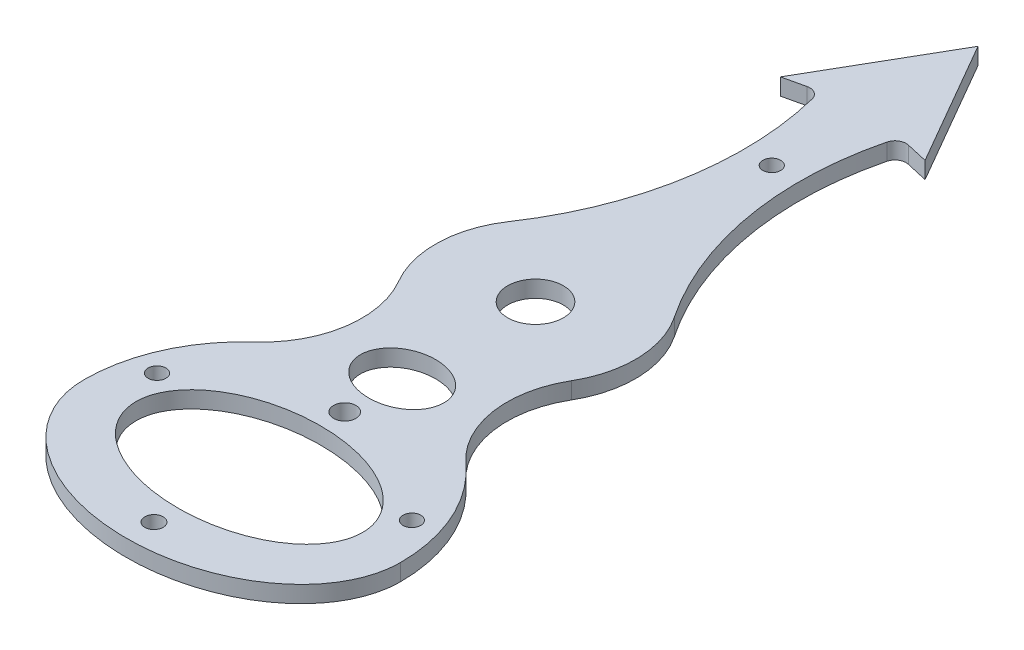
from build123d import *

# Parameters (mm, degrees)
SKETCH1_R           = 1.65
SKETCH1_R_2         = 1.6
SKETCH1_R_3         = 5
SKETCH1_R_4         = 2.015254326
BOSS_EXTRUDE1_DEPTH = 3
SKETCH2_RX          = 20.362751378
SKETCH2_RY          = 12.812950259
SKETCH2_RX_2        = 7.5
SKETCH2_RY_2        = 5.994654396
CUT_EXTRUDE1_DEPTH  = 85.488395158


with BuildPart() as part:
    # Sketch1 → Boss-Extrude1 (new body)
    with BuildSketch(Plane(origin=(0, 0, 0), x_dir=(1, 0, 0), z_dir=(0, 1, 0))):
        with BuildLine():
            Line((-12.992809169, 56.995794387), (0, 79.5))
            Line((0, 79.5), (12.992809169, 56.995794387))
            Line((12.992809169, 56.995794387), (9.092858534, 57.88483041))
            ThreePointArc((9.092858534, 57.88483041), (7.600012944, 57.63809004), (6.707195666, 56.416473867))
            ThreePointArc((6.707195666, 56.416473867), (5.884007309, 32.357320275), (14.898012861, 10.035397988))
            ThreePointArc((14.898012861, 10.035397988), (17.953839778, 0.565364674), (15.499897288, -9.078170745))
            ThreePointArc((15.499897288, -9.078170745), (13.251619002, -20.924420937), (19.000547774, -31.52339338))
            ThreePointArc((19.000547774, -31.52339338), (25.975787248, -41.10115667), (28.443609023, -52.689830928))
            add(Edge.make_bspline(
                [(-28.443609023, -52.689830928), (-28.443609023, -73.556390977), (0, -73.556390977), (28.443609023, -73.556390977), (28.443609023, -52.689830928)],
                knots=[0, 0, 0, 1.570796327, 1.570796327, 3.141592654, 3.141592654, 3.141592654], degree=2, weights=[1, 0.707106781, 1, 0.707106781, 1]))
            ThreePointArc((-28.443609023, -52.689830928), (-25.975787248, -41.10115667), (-19.000547774, -31.52339338))
            ThreePointArc((-19.000547774, -31.52339338), (-13.251619002, -20.924420937), (-15.499897288, -9.078170745))
            ThreePointArc((-15.499897288, -9.078170745), (-17.953839778, 0.565364674), (-14.898012861, 10.035397988))
            ThreePointArc((-14.898012861, 10.035397988), (-5.884007309, 32.357320275), (-6.707195666, 56.416473867))
            ThreePointArc((-6.707195666, 56.416473867), (-7.600012944, 57.63809004), (-9.092858534, 57.88483041))
            Line((-9.092858534, 57.88483041), (-12.992809169, 56.995794387))
        make_face()
        with Locations((0, -68.556390977)):
            Circle(SKETCH1_R, mode=Mode.SUBTRACT)
        with Locations((-22.896149501, -45.11234526)):
            Circle(SKETCH1_R_2, mode=Mode.SUBTRACT)
        with Locations((22.896149501, -45.11234526)):
            Circle(SKETCH1_R_2, mode=Mode.SUBTRACT)
        Circle(SKETCH1_R_3, mode=Mode.SUBTRACT)
        with Locations((0, 42.446284636)):
            Circle(SKETCH1_R_2, mode=Mode.SUBTRACT)
        with Locations((0, -34.278195489)):
            Circle(SKETCH1_R_4, mode=Mode.SUBTRACT)
    extrude(amount=BOSS_EXTRUDE1_DEPTH)

    # Sketch2 → Cut-Extrude1 (cut, through all)
    with BuildSketch(Plane(origin=(0, 3, 0), x_dir=(1, 0, 0), z_dir=(0, 1, 0))):
        with Locations((0, -51.417293233)):
            Ellipse(SKETCH2_RX, SKETCH2_RY)
        with Locations(Location((0, -23.957393608), (0, 0, 180))):
            Ellipse(SKETCH2_RX_2, SKETCH2_RY_2)
    extrude(amount=-CUT_EXTRUDE1_DEPTH, mode=Mode.SUBTRACT)


solid = part.part
